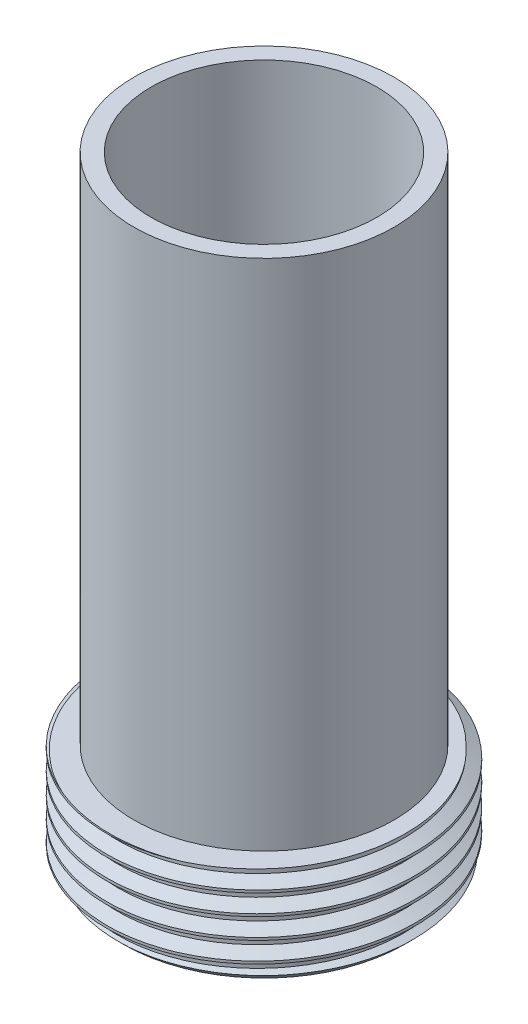
from build123d import *

# Parameters (mm, degrees)
SKETCH2_R           = 19
SKETCH2_R_2         = 16.5
BOSS_EXTRUDE1_DEPTH = 42
SKETCH3_R           = 22.5
SKETCH3_R_2         = 16.5
BOSS_EXTRUDE2_DEPTH = 15
SKETCH4_R           = 19
SKETCH4_R_2         = 16.5
BOSS_EXTRUDE4_DEPTH = 48
CUT_SWEEP7_PITCH    = 3


with BuildPart() as part:
    # Sketch2 → Boss-Extrude1 (new body)
    with BuildSketch(Plane(origin=(0, 0, 0), x_dir=(1, 0, 0), z_dir=(0, 1, 0))):
        with Locations(Location((0, 0, 0), (0, 0, 90))):
            Circle(SKETCH2_R)
        with Locations(Location((0, 0, 0), (0, 0, 90))):
            Circle(SKETCH2_R_2, mode=Mode.SUBTRACT)
    extrude(amount=BOSS_EXTRUDE1_DEPTH)

    # Sketch3 → Boss-Extrude2 (add)
    with BuildSketch(Plane.XZ):
        with Locations(Location((0, 0, 0), (0, 0, 270))):
            Circle(SKETCH3_R)
        with Locations(Location((0, 0, 0), (0, 0, 270))):
            Circle(SKETCH3_R_2, mode=Mode.SUBTRACT)
    extrude(amount=-BOSS_EXTRUDE2_DEPTH)

    # Sketch4 → Boss-Extrude4 (add)
    with BuildSketch(Plane(origin=(0, 42, 0), x_dir=(1, 0, 0), z_dir=(0, 1, 0))):
        with Locations(Location((0, 0, 0), (0, 0, 90))):
            Circle(SKETCH4_R)
        with Locations(Location((0, 0, 0), (0, 0, 90))):
            Circle(SKETCH4_R_2, mode=Mode.SUBTRACT)
    extrude(amount=BOSS_EXTRUDE4_DEPTH)

    # Cut-Sweep7: arcs per turn and ends read off the stored shape
    # Cut-Sweep7: the profile of Sketch18 profile screwed along a right-hand helix through 6.6 turns, 10 arcs to a turn; built about Z, then put on its axis
    cut_sweep7_z = Axis((0, 0, 0), (0, 0, 1))
    cut_sweep7_corners = [(22.5003, 0, -4.312645705), (22.5003, 0, -1.687354295), (20.87625, 0, -2.625), (20.87625, 0, -3.375)]
    with BuildLine(mode=Mode.PRIVATE) as cut_sweep7_profile:
        Line(cut_sweep7_corners[0], cut_sweep7_corners[1])
        Line(cut_sweep7_corners[1], cut_sweep7_corners[2])
        Line(cut_sweep7_corners[2], cut_sweep7_corners[3])
        Line(cut_sweep7_corners[3], cut_sweep7_corners[0])
    cut_sweep7_cap = Face(cut_sweep7_profile.wire())
    cut_sweep7_turn_angles = [0, 18, 36, 54, 72, 90, 108, 126, 144, 162, 180, 198, 216, 234, 252, 270, 288, 306, 324, 342, 360]
    cut_sweep7_turn_weights = [1, 0.9510565162951535, 1, 0.9510565162951535, 1, 0.9510565162951535, 1, 0.9510565162951535, 1, 0.9510565162951535, 1, 0.9510565162951535, 1, 0.9510565162951535, 1, 0.9510565162951535, 1, 0.9510565162951535, 1, 0.9510565162951535, 1]
    cut_sweep7_turn_rails = [Edge.make_bspline([Vector(p[0], p[1], 0).rotate(cut_sweep7_z, cut_sweep7_turn_angles[k]) / cut_sweep7_turn_weights[k] + Vector(0, 0, p[2] + CUT_SWEEP7_PITCH * cut_sweep7_turn_angles[k] / 360) for k in range(21)], [0, 0, 0, 1, 1, 2, 2, 3, 3, 4, 4, 5, 5, 6, 6, 7, 7, 8, 8, 9, 9, 10, 10, 10], 2, cut_sweep7_turn_weights) for p in cut_sweep7_corners]
    cut_sweep7_turn_sides = [Face.make_surface_from_curves(cut_sweep7_turn_rails[p[0]], cut_sweep7_turn_rails[p[1]]) for p in [(0, 1), (1, 2), (2, 3), (3, 0)]]
    cut_sweep7_last_angles = [2160, 2178, 2196, 2214, 2232, 2250, 2268, 2286, 2304, 2322, 2340, 2358, 2376]
    cut_sweep7_last_weights = [1, 0.9510565162951535, 1, 0.9510565162951535, 1, 0.9510565162951535, 1, 0.9510565162951535, 1, 0.9510565162951535, 1, 0.9510565162951535, 1]
    cut_sweep7_last_rails = [Edge.make_bspline([Vector(p[0], p[1], 0).rotate(cut_sweep7_z, cut_sweep7_last_angles[k]) / cut_sweep7_last_weights[k] + Vector(0, 0, p[2] + CUT_SWEEP7_PITCH * cut_sweep7_last_angles[k] / 360) for k in range(13)], [0, 0, 0, 1, 1, 2, 2, 3, 3, 4, 4, 5, 5, 6, 6, 6], 2, cut_sweep7_last_weights) for p in cut_sweep7_corners]
    cut_sweep7_last_sides = [Face.make_surface_from_curves(cut_sweep7_last_rails[p[0]], cut_sweep7_last_rails[p[1]]) for p in [(0, 1), (1, 2), (2, 3), (3, 0)]]
    cut_sweep7 = Plane(origin=(0, 0, 0), x_dir=(0, 0, -1), z_dir=(0, 1, 0)) * Solid(Shell([*[p.moved(Location((0, 0, CUT_SWEEP7_PITCH * i))) for i in range(6) for p in cut_sweep7_turn_sides], *cut_sweep7_last_sides, cut_sweep7_cap, cut_sweep7_cap.rotate(cut_sweep7_z, 2376).moved(Location((0, 0, CUT_SWEEP7_PITCH * 2376 / 360)))]))
    add(cut_sweep7, mode=Mode.SUBTRACT)

    # Sketch19 → Cut-Revolve1 (revolve, cut)
    with BuildSketch(Plane.XY, mode=Mode.PRIVATE) as cut_revolve1_sk:
        Polygon((22.5, 2), (22.5, 0), (20.5, 0), align=None)
    revolve(cut_revolve1_sk.sketch.rotate(Axis((0, 0, 0), (0, 1, 0)), 180.14754491), axis=Axis((0, 0, 0), (0, 1, 0)), mode=Mode.SUBTRACT)


solid = part.part
